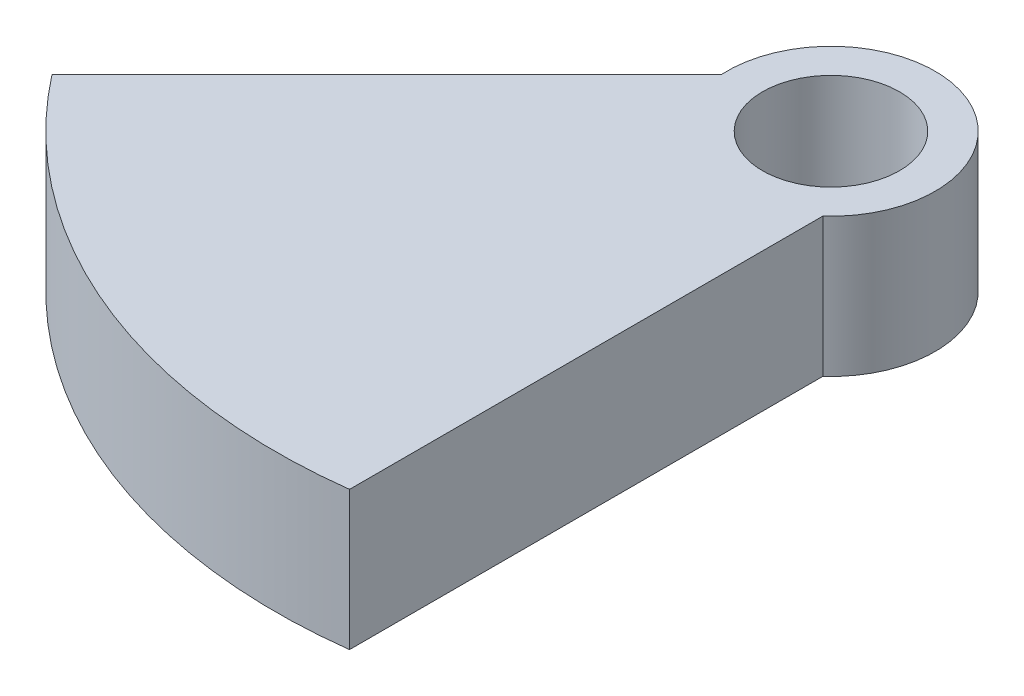
from build123d import *

# Parameters (mm, degrees)
SKETCH1_R           = 9.398
BOSS_EXTRUDE2_DEPTH = 19.05


with BuildPart() as part:
    # Sketch1 → Boss-Extrude2 (new body)
    with BuildSketch(Plane(origin=(0, 0, 0), x_dir=(1, 0, 0), z_dir=(0, 1, 0))):
        with BuildLine():
            Line((9.525, -75.602343714), (9.525, -10.649273743))
            ThreePointArc((9.525, -10.649273743), (5.46758954, 13.199928821), (-14.265365769, -0.794981587))
            Line((-14.265365769, -0.794981587), (-60.194122004, -46.723737823))
            ThreePointArc((-60.194122004, -46.723737823), (-29.160477546, -70.399620377), (9.525, -75.602343714))
        make_face()
        Circle(SKETCH1_R, mode=Mode.SUBTRACT)
    extrude(amount=BOSS_EXTRUDE2_DEPTH)


solid = part.part
